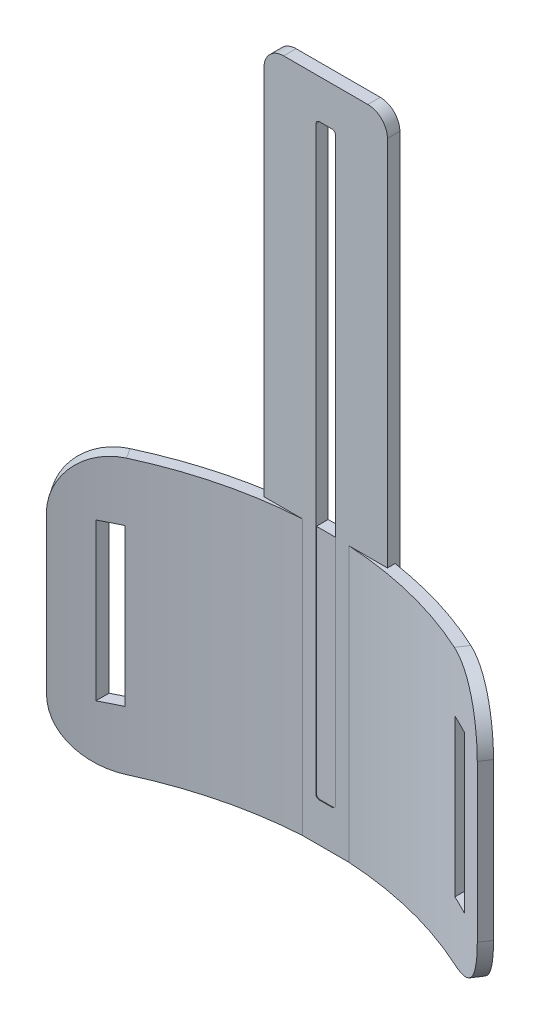
from build123d import *

# Parameters (mm, degrees)
SKETCH1_W           = 31.5
SKETCH1_H           = 170
SKETCH1_W_2         = 5.08
SKETCH1_H_2         = 150
BOSS_EXTRUDE1_DEPTH = 3.175
FILLET1_R           = 1
FILLET2_R           = 5
BOSS_EXTRUDE2_DEPTH = 70
FILLET3_R           = 15
SKETCH4_W           = 5
SKETCH4_H           = 40
CUT_EXTRUDE5_DEPTH  = 104.989569915


with BuildPart() as part:
    # Sketch1 → Boss-Extrude1 (new body)
    with BuildSketch(Plane.XY):
        Rectangle(SKETCH1_W, SKETCH1_H)
        Rectangle(SKETCH1_W_2, SKETCH1_H_2, mode=Mode.SUBTRACT)
    extrude(amount=BOSS_EXTRUDE1_DEPTH)

    # Fillet1
    fillet1_edges = [part.edges().sort_by_distance(p)[0] for p in [
        (2.54, -75, 1.5875),
        (-2.54, -75, 1.5875),
        (2.54, 75, 1.5875),
        (-2.54, 75, 1.5875),
    ]]
    fillet(fillet1_edges, radius=FILLET1_R)

    # Fillet2
    fillet2_edges = [part.edges().sort_by_distance(p)[0] for p in [
        (15.75, -85, 1.5875),
        (-15.75, -85, 1.5875),
        (15.75, 85, 1.5875),
        (-15.75, 85, 1.5875),
    ]]
    fillet(fillet2_edges, radius=FILLET2_R)

    # Sketch3 → Boss-Extrude2 (add)
    with BuildSketch(Plane(origin=(0, -85, 0), x_dir=(1, 0, 0), z_dir=(0, 1, 0))):
        with BuildLine():
            Line((-56.65, -16.978040594), (-55, -19.483534558))
            ThreePointArc((-55, -19.483534558), (0, -3), (55, -19.483534558))
            Line((55, -19.483534558), (56.65, -16.978040594))
            ThreePointArc((56.65, -16.978040594), (0, 0), (-56.65, -16.978040594))
        make_face()
    extrude(amount=BOSS_EXTRUDE2_DEPTH)

    # Fillet3
    fillet3_edges = [part.edges().sort_by_distance(p)[0] for p in [
        (55.825, -15, 18.230787576),
        (55.825, -85, 18.230787576),
        (-55.825, -85, 18.230787576),
        (-55.825, -15, 18.230787576),
    ]]
    fillet(fillet3_edges, radius=FILLET3_R)

    # Sketch4 → Cut-Extrude5 (cut, symmetric)
    with BuildSketch(Plane.XY):
        with Locations((-44.5945609, -50)):
            Rectangle(SKETCH4_W, SKETCH4_H)
    cut_extrude5 = extrude(amount=CUT_EXTRUDE5_DEPTH, both=True, mode=Mode.SUBTRACT)

    # Mirror1: Cut-Extrude5 across plane
    add(cut_extrude5.mirror(Plane(origin=(0, 0, 0), x_dir=(0, 0, 1), z_dir=(1, 0, 0))), mode=Mode.SUBTRACT)


solid = part.part
